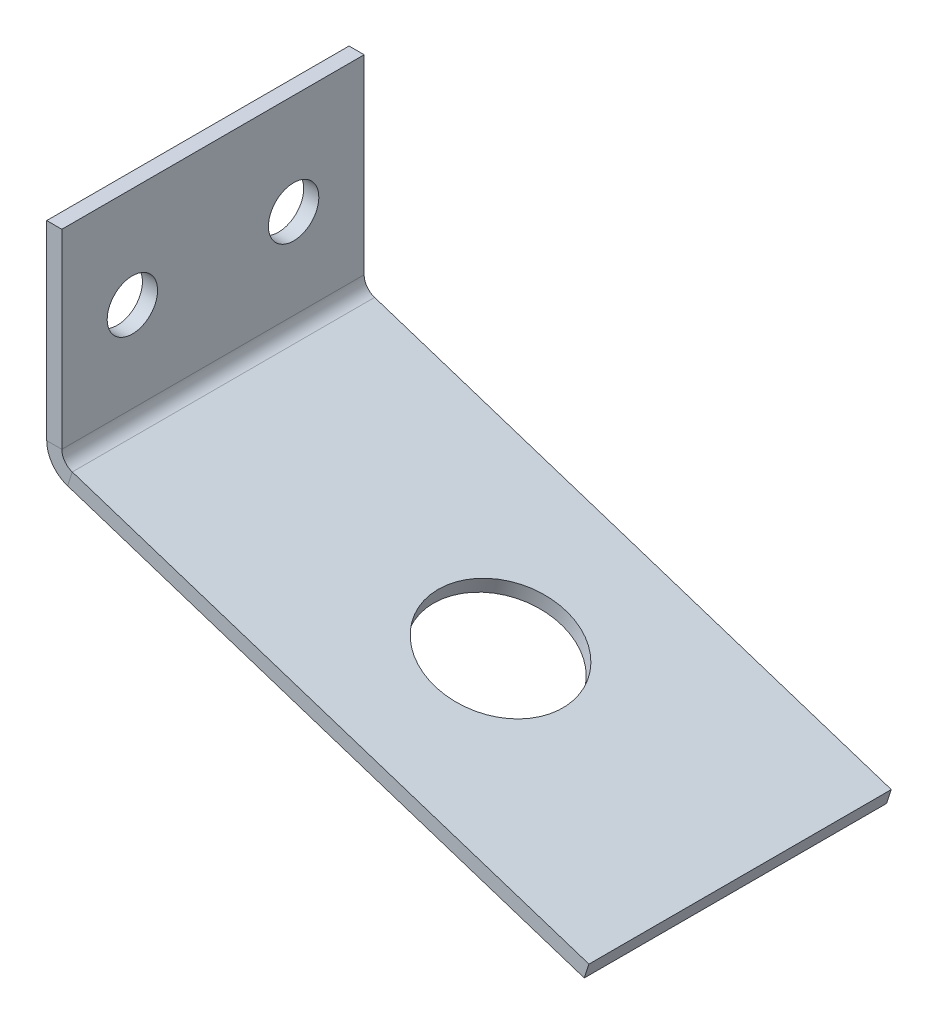
from build123d import *

# Parameters (mm, degrees)
SM_BASE_FLANGE_1_DEPTH = 15
SKETCH_6_R             = 2.5
CUT_EXTRUDE_664_DEPTH  = 10
SKETCH_7_R             = 6.5
CUT_EXTRUDE_2_DEPTH    = 10


# Sheet-metal steps are written as plain solids
with BuildPart() as part:
    # Sketch 1 → Базовая кромка1 (new, symmetric)
    with BuildSketch(Plane.XY):
        with BuildLine():
            Line((0, 20), (0, 1.089813792))
            ThreePointArc((0, 1.089813792), (0.286474508, 0.208135914), (1.036474508, -0.336770982))
            Line((1.036474508, -0.336770982), (52.308108396, -16.995934691))
            Line((52.308108396, -16.995934691), (51.844582905, -18.422519465))
            Line((51.844582905, -18.422519465), (0.572949017, -1.763355757))
            ThreePointArc((0.572949017, -1.763355757), (-0.927050983, -0.673541965), (-1.5, 1.089813792))
            Line((-1.5, 1.089813792), (-1.5, 20))
            Line((-1.5, 20), (0, 20))
        make_face()
    extrude(amount=SM_BASE_FLANGE_1_DEPTH, both=True)

    # Эскиз6 → Cut-Extrude 664 (cut)
    with BuildSketch(Plane(origin=(0, 0, 0), x_dir=(0, 0, -1), z_dir=(1, 0, 0))):
        with Locations(Location((-8, 10, 0), (0, 0, 90))):
            Circle(SKETCH_6_R)
        with Locations(Location((8, 10, 0), (0, 0, 90))):
            Circle(SKETCH_6_R)
    extrude(amount=-CUT_EXTRUDE_664_DEPTH, mode=Mode.SUBTRACT)

    # Эскиз7 → Вырез-Вытянуть2 (cut)
    with BuildSketch(Plane(origin=(0, 0, 0), x_dir=(0.9510565162951546, -0.3090169943749447, 0), z_dir=(0.3090169943749447, 0.9510565162951546, 0))):
        with Locations(Location((30, 0, 0), (0, 0, 180))):
            Circle(SKETCH_7_R)
    extrude(amount=-CUT_EXTRUDE_2_DEPTH, mode=Mode.SUBTRACT)


solid = part.part
